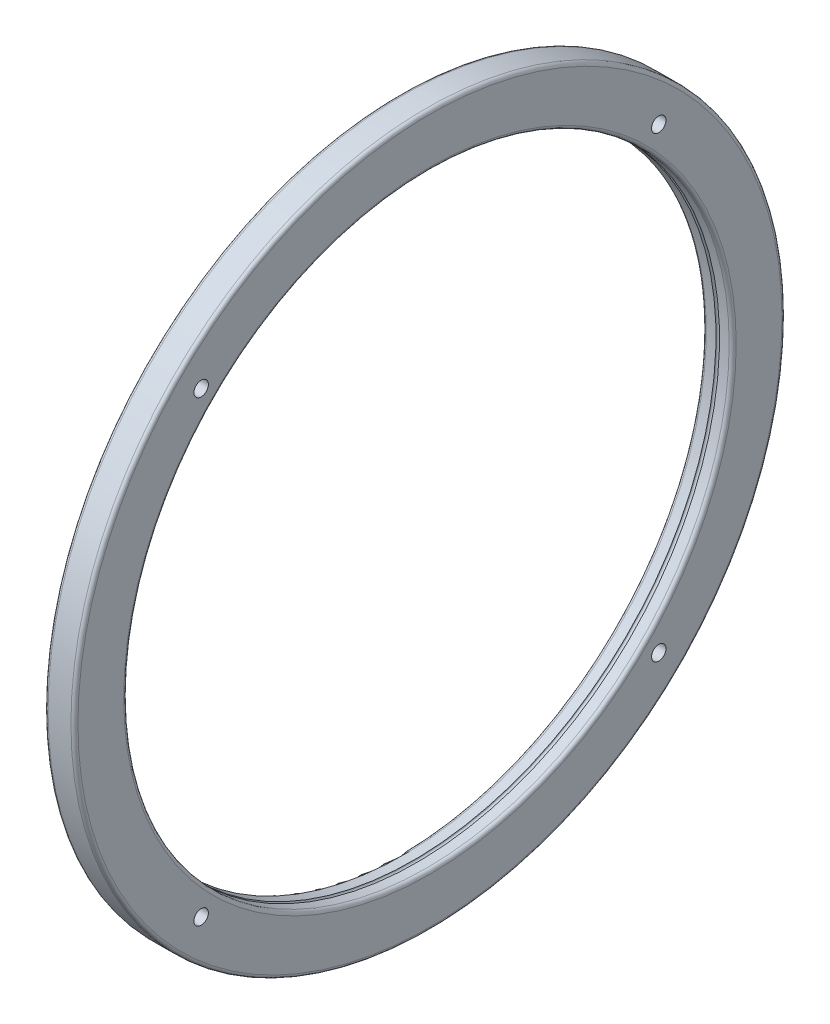
from build123d import *

# Parameters (mm, degrees)
FILLET1_R          = 1
CUT_EXTRUDE1_REACH = 145.088
SKETCH3_R          = 2.05


with BuildPart() as part:
    # Sketch1 → Revolve1 (revolve)
    with BuildSketch(Plane(origin=(0, 0, 0), x_dir=(1, 0, 0), z_dir=(0, 1, 0))):
        with BuildLine():
            Line((-4.25, 101), (4.25, 101))
            Line((4.25, 101), (4.25, 86))
            Line((4.25, 86), (0.501586867, 86))
            ThreePointArc((0.501586867, 86), (0.001586867, 86.5), (-0.498413133, 86))
            Line((-0.498413133, 86), (-4.25, 86))
            Line((-4.25, 86), (-4.25, 101))
        make_face()
    revolve(axis=Axis((0, 0, 0), (1, 0, 0)))

    # Fillet1
    fillet1_edges = [part.edges().sort_by_distance(p)[0] for p in [
        (-4.25, 0, 86),
        (4.25, 0, 86),
        (4.25, 0, 101),
        (-4.25, 0, 101),
    ]]
    fillet(fillet1_edges, radius=FILLET1_R)

    # Sketch3 → Cut-Extrude1 (cut, up to next)
    with BuildSketch(Plane(origin=(4.25, 0, 0), x_dir=(0, 0, -1), z_dir=(1, 0, 0)), mode=Mode.PRIVATE) as cut_extrude1_sk1:
        with Locations((-65, -65)):
            Circle(SKETCH3_R)
    cut_extrude1_tool1 = extrude(cut_extrude1_sk1.sketch, amount=-CUT_EXTRUDE1_REACH, mode=Mode.PRIVATE) & part.part
    # Sketch3 → Cut-Extrude1 (cut, up to next)
    with BuildSketch(Plane(origin=(4.25, 0, 0), x_dir=(0, 0, -1), z_dir=(1, 0, 0)), mode=Mode.PRIVATE) as cut_extrude1_sk2:
        with Locations((-65, 65)):
            Circle(SKETCH3_R)
    cut_extrude1_tool2 = extrude(cut_extrude1_sk2.sketch, amount=-CUT_EXTRUDE1_REACH, mode=Mode.PRIVATE) & part.part
    # Sketch3 → Cut-Extrude1 (cut, up to next)
    with BuildSketch(Plane(origin=(4.25, 0, 0), x_dir=(0, 0, -1), z_dir=(1, 0, 0)), mode=Mode.PRIVATE) as cut_extrude1_sk3:
        with Locations((65, 65)):
            Circle(SKETCH3_R)
    cut_extrude1_tool3 = extrude(cut_extrude1_sk3.sketch, amount=-CUT_EXTRUDE1_REACH, mode=Mode.PRIVATE) & part.part
    # Sketch3 → Cut-Extrude1 (cut, up to next)
    with BuildSketch(Plane(origin=(4.25, 0, 0), x_dir=(0, 0, -1), z_dir=(1, 0, 0)), mode=Mode.PRIVATE) as cut_extrude1_sk4:
        with Locations((65, -65)):
            Circle(SKETCH3_R)
    cut_extrude1_tool4 = extrude(cut_extrude1_sk4.sketch, amount=-CUT_EXTRUDE1_REACH, mode=Mode.PRIVATE) & part.part
    add(cut_extrude1_tool1.solids().sort_by_distance((4.25, -65, 65))[0], mode=Mode.SUBTRACT)
    add(cut_extrude1_tool2.solids().sort_by_distance((4.25, 65, 65))[0], mode=Mode.SUBTRACT)
    add(cut_extrude1_tool3.solids().sort_by_distance((4.25, 65, -65))[0], mode=Mode.SUBTRACT)
    add(cut_extrude1_tool4.solids().sort_by_distance((4.25, -65, -65))[0], mode=Mode.SUBTRACT)


solid = part.part
